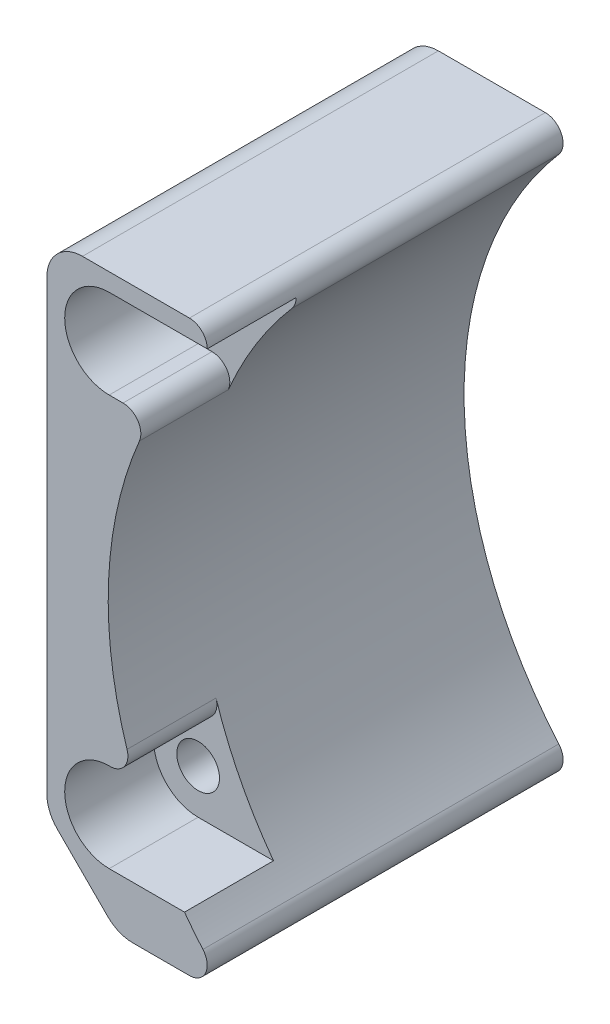
from build123d import *

# Parameters (mm, degrees)
BOSS_EXTRUDE1_DEPTH = 31.75
CHAMFER1_SIZE       = 6.35
SKETCH3_R           = 1.905
CUT_EXTRUDE1_DEPTH  = 63.116395933
FILLET1_R           = 3.175
CUT_EXTRUDE4_START  = -7.9375
CUT_EXTRUDE4_DEPTH  = 7.9375
FILLET3_R           = 1.5875
FILLET5_R           = 1.5875


with BuildPart() as part:
    # Sketch2 → Boss-Extrude1 (new body)
    with BuildSketch(Plane.XY):
        with BuildLine():
            Line((0, 0), (16.423889421, 0))
            ThreePointArc((16.423889421, 0), (5.469613753, 25.4), (16.423889421, 50.8))
            Line((16.423889421, 50.8), (0, 50.8))
            Line((0, 50.8), (0, 0))
        make_face()
    extrude(amount=BOSS_EXTRUDE1_DEPTH)

    # Chamfer1
    chamfer1_edges = [part.edges().sort_by_distance(p)[0] for p in [
        (0, 0, 15.875),
    ]]
    chamfer(chamfer1_edges, length=CHAMFER1_SIZE)

    # Sketch3 → Cut-Extrude1 (cut, through all)
    with BuildSketch(Plane.XY.offset(31.75)):
        with Locations((5.55625, 45.24375)):
            Circle(SKETCH3_R)
        with Locations((5.55625, 8.651474106)):
            Circle(SKETCH3_R)
    extrude(amount=-CUT_EXTRUDE1_DEPTH, mode=Mode.SUBTRACT)

    # Fillet1
    fillet1_edges = [part.edges().sort_by_distance(p)[0] for p in [
        (6.35, 0, 15.875),
        (0, 6.35, 15.875),
        (0, 50.8, 15.875),
    ]]
    fillet(fillet1_edges, radius=FILLET1_R)

    # Sketch6 → Cut-Extrude4 (cut)
    with BuildSketch(Plane.XY.offset(31.75).offset(CUT_EXTRUDE4_START)):
        with BuildLine():
            Line((5.55625, 49.2125), (14.846219112, 49.2125))
            ThreePointArc((14.846219112, 49.2125), (11.789501217, 45.437543807), (9.28609402, 41.275))
            Line((9.28609402, 41.275), (5.55625, 41.275))
            ThreePointArc((5.55625, 41.275), (1.5875, 45.24375), (5.55625, 49.2125))
        make_face()
        with BuildLine():
            Line((5.55625, 12.620224106), (7.891799212, 12.620224106))
            ThreePointArc((7.891799212, 12.620224106), (9.826115993, 8.508505996), (12.27789089, 4.682724106))
            Line((12.27789089, 4.682724106), (5.55625, 4.682724106))
            ThreePointArc((5.55625, 4.682724106), (1.5875, 8.651474106), (5.55625, 12.620224106))
        make_face()
    extrude(amount=CUT_EXTRUDE4_DEPTH, mode=Mode.SUBTRACT)

    # Fillet3
    fillet3_edges = [part.edges().sort_by_distance(p)[0] for p in [
        (16.423889421, 0, 15.875),
        (16.423889421, 50.8, 15.875),
    ]]
    fillet(fillet3_edges, radius=FILLET3_R)

    # Fillet5
    fillet5_edges = [part.edges().sort_by_distance(p)[0] for p in [
        (7.891799212, 12.620224106, 27.78125),
        (9.28609402, 41.275, 27.78125),
    ]]
    fillet(fillet5_edges, radius=FILLET5_R)


solid = part.part
